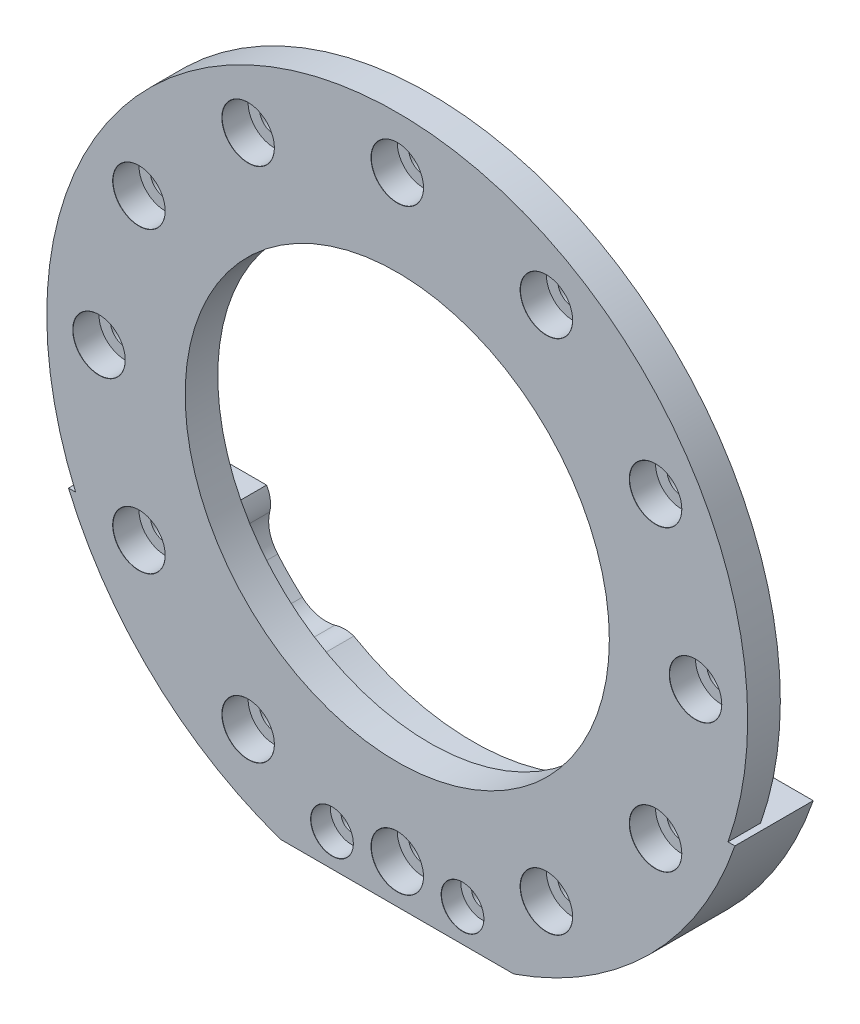
from build123d import *

# Parameters (mm, degrees)
BOSS_EXTRUDE1_DEPTH     = 7
BOSS_EXTRUDE2_OUTLINE_R = 32.5
BOSS_EXTRUDE2_DEPTH     = 5
CUT_EXTRUDE1_START      = -10
CUT_EXTRUDE1_DEPTH      = 10
CIRPATTERN1_COUNT       = 12


# Read off the part's stored shape, not the designer's step: Boss-Extrude2, CBORE for M3 SHCS1
with BuildPart() as part:
    # Sketch1 → Boss-Extrude1 (new body)
    with BuildSketch(Plane.XY):
        with BuildLine():
            Line((0, 0), (-0.403978912, 15.69480172))
            ThreePointArc((-0.403978912, 15.69480172), (-9.850874058, 16.938509061), (-18.653978912, 20.584874482))
            ThreePointArc((-18.653978912, 20.584874482), (-20.11149054, 20.82324131), (-21.567676923, 20.576907974))
            ThreePointArc((-21.567676923, 20.576907974), (-24.205855638, 20.575365577), (-26.541253498, 21.802519254))
            ThreePointArc((-26.541253498, 21.802519254), (-28.493972378, 23.657335535), (-30.31737883, 25.639416102))
            ThreePointArc((-30.31737883, 25.639416102), (-31.544532507, 27.974813962), (-31.54299011, 30.612992677))
            ThreePointArc((-31.54299011, 30.612992677), (-31.455305934, 32.324569937), (-32.01390615, 33.94480172))
            Line((-32.01390615, 33.94480172), (-51.738215412, 33.94480172))
            ThreePointArc((-51.738215412, 33.94480172), (-38.72021408, 13.062776736), (-17.866169147, 0))
            Line((-17.866169147, 0), (0, 0))
        make_face()
        with BuildLine():
            ThreePointArc((17.846021088, 20.584874482), (9.042916235, 16.938509061), (-0.403978912, 15.69480172))
            Line((-0.403978912, 15.69480172), (0, 0))
            Line((0, 0), (17.866169147, 0))
            ThreePointArc((17.866169147, 0), (38.72021408, 13.062776736), (51.738215412, 33.94480172))
            Line((51.738215412, 33.94480172), (31.205948327, 33.94480172))
            ThreePointArc((31.205948327, 33.94480172), (30.756396425, 32.859487423), (30.603062644, 31.69480172))
            ThreePointArc((30.603062644, 31.69480172), (30.636176894, 31.149887325), (30.735032287, 30.612992677))
            ThreePointArc((30.735032287, 30.612992677), (30.855855546, 29.956788108), (30.896328518, 29.290781625))
            ThreePointArc((30.896328518, 29.290781625), (30.537924024, 27.337836245), (29.509421007, 25.639416102))
            ThreePointArc((29.509421007, 25.639416102), (27.880292336, 23.910530473), (26.151406706, 22.281401802))
            ThreePointArc((26.151406706, 22.281401802), (23.816008846, 21.054248125), (21.177830131, 21.055790522))
            ThreePointArc((21.177830131, 21.055790522), (19.466252872, 21.143474697), (17.846021088, 20.584874482))
        make_face()
    extrude(amount=BOSS_EXTRUDE1_DEPTH)

    # Boss-Extrude2 outline → Boss-Extrude2 (add)
    with BuildSketch(Plane.XY.offset(7)):
        with BuildLine():
            Line((-17.866169147, 0), (17.866169147, 0))
            ThreePointArc((17.866169147, 0), (0, 106.4), (-17.866169147, 0))
        make_face()
        with Locations((0, 51.7)):
            Circle(BOSS_EXTRUDE2_OUTLINE_R, mode=Mode.SUBTRACT)
    extrude(amount=BOSS_EXTRUDE2_DEPTH)

    # Sketch4 → Cut-Extrude1 (cut)
    with BuildSketch(Plane.XY.offset(12).offset(CUT_EXTRUDE1_START)):
        with BuildLine():
            ThreePointArc((51.738215412, 33.94480172), (-1.913911899, 106.366506576), (-50.369813341, 30.369929583))
            Line((-50.369813341, 30.369929583), (-49.282026095, 30.369929583))
            ThreePointArc((-49.282026095, 30.369929583), (-1.919212398, 105.365693173), (50.679807952, 33.94480172))
            Line((50.679807952, 33.94480172), (51.738215412, 33.94480172))
        make_face()
    extrude(amount=CUT_EXTRUDE1_DEPTH, mode=Mode.SUBTRACT)

    # CBORE for M3 SHCS1 outline → CBORE for M3 SHCS1 (revolve, cut)
    with BuildSketch(Plane(origin=(10, 5, 0), x_dir=(1, 0, 0), z_dir=(0, -1, 0))):
        Polygon((0, 0), (1.6, 0), (1.6, 9), (3.25, 9), (3.25, 11.975), (3.275, 12), (0, 12), align=None)
    revolve(axis=Axis((10, 5, 0), (0, 0, 1)), mode=Mode.SUBTRACT)

    # CBORE for M3 SHCS1 2 outline → CBORE for M3 SHCS1 2 (revolve, cut)
    with BuildSketch(Plane(origin=(-10, 5, 0), x_dir=(1, 0, 0), z_dir=(0, -1, 0))):
        Polygon((0, 12), (0, 0), (1.6, 0), (1.6, 9), (3.25, 9), (3.25, 11.975), (3.275, 12), align=None)
    revolve(axis=Axis((-10, 5, 0), (0, 0, 1)), mode=Mode.SUBTRACT)

    # Sketch10 → CBORE for M4 SHCS2 (revolve, cut)
    with BuildSketch(Plane(origin=(0, 97.4, 12), x_dir=(0, -1, 0), z_dir=(1, 0, 0))):
        Polygon((0, 0), (0, 12), (2.25, 12), (2.25, 4), (4, 4), (4, 0.025), (4.025, 0), align=None)
    cbore_for_m4_shcs2 = revolve(axis=Axis((0, 97.4, 18.35), (0, 0, -1)), mode=Mode.SUBTRACT)

    # CirPattern1: CBORE for M4 SHCS2 ×12 about axis
    cirpattern1_axis = Axis((0, 51.7, 0), (0, 0, 1))
    for i in range(1, CIRPATTERN1_COUNT):
        add(cbore_for_m4_shcs2.rotate(cirpattern1_axis, i * 360 / CIRPATTERN1_COUNT), mode=Mode.SUBTRACT)


solid = part.part
